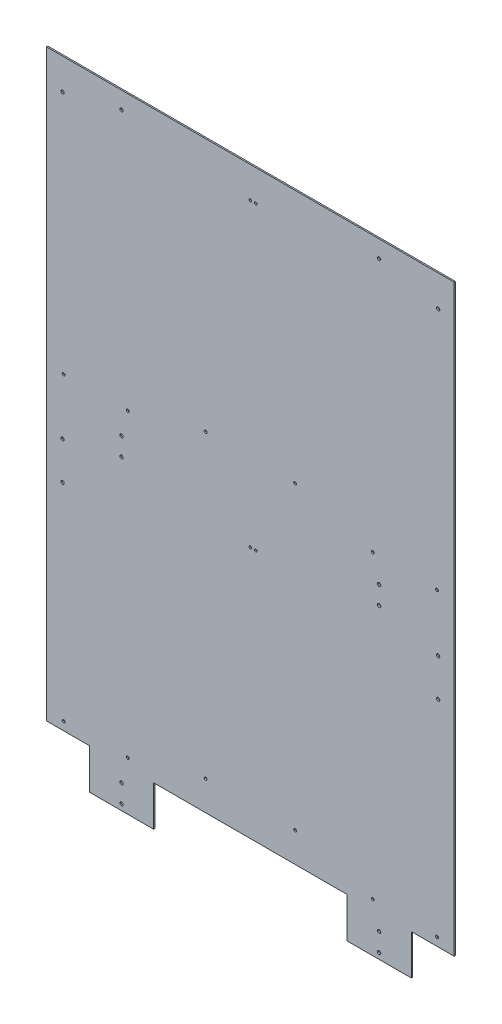
from build123d import *

# Parameters (mm, degrees)
BOSS_EXTRUDE1_DEPTH            = 3.175
F_1_4_CLEARANCE_HOLE1_D        = 6.7564
F_5_16_0_3125_DIAMETER_HOLE1_D = 7.9375
SKETCH7_W                      = 965.2
SKETCH7_H                      = 27.94
CUT_EXTRUDE1_DEPTH             = 1491.022459772
F_1_4_0_25_DIAMETER_HOLE1_D    = 6.35


with BuildPart() as part:
    # Sketch2 → Boss-Extrude1 (new body)
    with BuildSketch(Plane.XY):
        Polygon((-482.6, 0), (-381, 0), (-381, -95.25), (-228.6, -95.25), (-228.6, 0), (228.6, 0), (228.6, -95.25), (381, -95.25), (381, 0), (482.6, 0), (482.6, 1409.7), (-482.6, 1409.7), align=None)
    extrude(amount=BOSS_EXTRUDE1_DEPTH)

    # 1/4 Clearance Hole1 (through all)
    with Locations(Plane.XY.offset(3.175)):
        with Locations((441.96, 730.60918615), (105.907561142, 70.010143283), (289.91643105, 20.705115191), (-289.91643105, 20.705115191), (-105.907561142, 70.010143283), (105.907561142, 781.210143283), (289.91643105, 731.905115191), (-289.91643105, 731.905115191), (-105.907561142, 781.210143283), (441.96, 19.40918615), (-441.96, 19.40918615), (-441.96, 730.60918615)):
            Hole(F_1_4_CLEARANCE_HOLE1_D / 2)

    # 5/16 (0.3125) Diameter Hole1 (through all)
    with Locations(Plane.XY.offset(3.175)):
        with Locations((444.5, 508), (-304.8, 1341.12), (304.8, 1341.12), (-304.8, 673.1), (-304.8, 629.92), (304.8, 673.1), (304.8, 629.92), (-304.8, -38.1), (-304.8, -81.28), (304.8, -38.1), (304.8, -81.28), (-444.5, 1308.1), (444.5, 1308.1), (-444.5, 596.9), (444.5, 596.9), (-444.5, 508)):
            Hole(F_5_16_0_3125_DIAMETER_HOLE1_D / 2)

    # Sketch7 → Cut-Extrude1 (cut, through all)
    with BuildSketch(Plane.XY.offset(3.175)):
        with Locations((0, 1395.73)):
            Rectangle(SKETCH7_W, SKETCH7_H)
    extrude(amount=-CUT_EXTRUDE1_DEPTH, mode=Mode.SUBTRACT)

    # 1/4 (0.25) Diameter Hole1 (through all)
    with Locations(Plane.XY.offset(3.175)):
        with Locations((0, 1308.1), (0, 596.9), (12.7, 1308.1), (12.7, 596.9)):
            Hole(F_1_4_0_25_DIAMETER_HOLE1_D / 2)


solid = part.part
